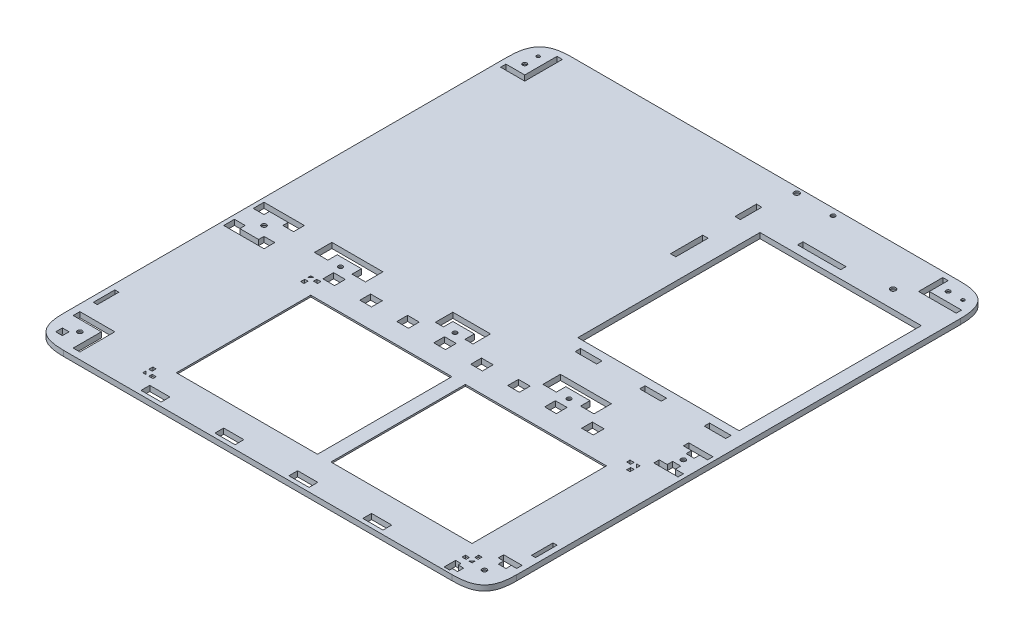
from build123d import *

# Parameters (mm, degrees)
SKETCH1_W                                    = 337
SKETCH1_H                                    = 377.97
SKETCH1_W_2                                  = 240
SKETCH1_H_2                                  = 120
BOSS_EXTRUDE1_DEPTH                          = 4
FILLET1_SIZE                                 = 24
SKETCH3_R                                    = 1.75
SKETCH3_R_2                                  = 2
SKETCH3_R_3                                  = 1.6
SKETCH3_R_4                                  = 1.2
SKETCH3_W                                    = 5
SKETCH3_H                                    = 5
SKETCH3_W_2                                  = 3
SKETCH3_H_2                                  = 16
SKETCH3_W_3                                  = 4
SKETCH3_H_3                                  = 24
SKETCH3_W_4                                  = 120
SKETCH3_H_4                                  = 135.5
SKETCH3_W_5                                  = 16
SKETCH3_H_5                                  = 4
SKETCH3_W_6                                  = 32
CUT_EXTRUDE1_DEPTH                           = 4
CUT_EXTRUDE2_REACH                           = 508.405
SKETCH5_W                                    = 2.5
SKETCH5_H                                    = 3
SKETCH5_W_2                                  = 3
SKETCH5_H_2                                  = 2.5
MIRROR1_AT_THE_SECOND_PLANE_COPY_1_REACH     = 508.405
MIRROR1_AT_THE_SECOND_PLANE_COPY_1_SKETC_W   = 2.5
MIRROR1_AT_THE_SECOND_PLANE_COPY_1_SKETC_H   = 3
MIRROR1_AT_THE_SECOND_PLANE_COPY_1_SKETC_W_2 = 3
MIRROR1_AT_THE_SECOND_PLANE_COPY_1_SKETC_H_2 = 2.5
SKETCH6_R                                    = 3.5
SKETCH6_R_2                                  = 3
CUT_EXTRUDE3_DEPTH                           = 2.8
CUT_EXTRUDE4_REACH                           = 508.405
SKETCH7_W                                    = 8.7
SKETCH7_H                                    = 8
LPATTERN1_COUNT                              = 8
LPATTERN1_PITCH                              = 27.5
CUT_EXTRUDE5_REACH                           = 508.405
CUT_EXTRUDE6_REACH                           = 508.405
SKETCH9_R                                    = 1.6
SKETCH10_R                                   = 3.5
CUT_EXTRUDE7_DEPTH                           = 2.8
CUT_EXTRUDE8_REACH                           = 508.405
SKETCH11_R                                   = 1.6
SKETCH12_R                                   = 3.5
CUT_EXTRUDE9_DEPTH                           = 2.8
SKETCH13_W                                   = 15
SKETCH13_H                                   = 6.5
CUT_EXTRUDE10_DEPTH                          = 4
LPATTERN2_COUNT                              = 4
LPATTERN2_PITCH                              = 55
SKETCH15_W                                   = 240
SKETCH15_H                                   = 120
SKETCH15_W_2                                 = 105
SKETCH15_H_2                                 = 100
BOSS_EXTRUDE2_DEPTH                          = 1.2


with BuildPart() as part:
    # Sketch1 → Boss-Extrude1 (new body)
    with BuildSketch(Plane(origin=(0, 0, 0), x_dir=(1, 0, 0), z_dir=(0, 1, 0))):
        with Locations((168.5, 188.985)):
            Rectangle(SKETCH1_W, SKETCH1_H)
        with Locations((190.28, 77.5)):
            Rectangle(SKETCH1_W_2, SKETCH1_H_2, mode=Mode.SUBTRACT)
    extrude(amount=-BOSS_EXTRUDE1_DEPTH)

    # Fillet1
    # a fillet whose section is not a circle: 24 mm, written as the material it takes off along each edge
    with BuildSketch(Plane(origin=(0, 60, 0), x_dir=(1, 0, 0), z_dir=(0, -1, 0))) as fillet1_piece_1:
        with BuildLine():
            Bezier((FILLET1_SIZE, 0), (0, 0), (0, -FILLET1_SIZE), weights=[1, 1.222222222, 1])
            Line((0, -FILLET1_SIZE), (0, 0))
            Line((0, 0), (FILLET1_SIZE, 0))
        make_face()
    extrude(amount=124, mode=Mode.SUBTRACT)
    with BuildSketch(Plane(origin=(337, 60, 0), x_dir=(-1, 0, 0), z_dir=(0, -1, 0)), Plane(origin=(0, 60, -377.97), x_dir=(1, 0, 0), z_dir=(0, -1, 0)), Plane(origin=(337, 60, -377.97), x_dir=(0, 0, 1), z_dir=(0, -1, 0))) as fillet1_piece_2:
        with BuildLine():
            Bezier((FILLET1_SIZE, 0), (0, 0), (0, FILLET1_SIZE), weights=[1, 1.222222222, 1])
            Line((0, FILLET1_SIZE), (0, 0))
            Line((0, 0), (FILLET1_SIZE, 0))
        make_face()
    extrude(amount=124, mode=Mode.SUBTRACT)

    # Sketch3 → Cut-Extrude1 (cut)
    with BuildSketch(Plane(origin=(0, 0, 0), x_dir=(1, 0, 0), z_dir=(0, 1, 0))):
        with Locations(Location((322, 15, 0), (0, 0, 270))):
            Circle(SKETCH3_R)
        with Locations(Location((18, 18, 0), (0, 0, 270))):
            Circle(SKETCH3_R)
        with Locations(Location((18, 155, 0), (0, 0, 270))):
            Circle(SKETCH3_R)
        with Locations(Location((325, 160, 0), (0, 0, 270))):
            Circle(SKETCH3_R)
        with Locations(Location((195.4, 373.97, 0), (0, 0, 270))):
            Circle(SKETCH3_R_2)
        with Locations(Location((293, 347.97, 0), (0, 0, 270))):
            Circle(SKETCH3_R_2)
        with Locations(Location((315, 366.97, 0), (0, 0, 270))):
            Circle(SKETCH3_R_3)
        with Locations(Location((326, 366.97, 0), (0, 0, 270))):
            Circle(SKETCH3_R_4)
        with Locations(Location((11, 355.97, 0), (0, 0, 270))):
            Circle(SKETCH3_R_3)
        with Locations(Location((11, 365.97, 0), (0, 0, 270))):
            Circle(SKETCH3_R_4)
        with Locations(Location((223.4, 372.97, 0), (0, 0, 270))):
            Circle(SKETCH3_R_3)
        Polygon((309, 4), (309, 2), (305, 2), (305, 10.5), (309, 10.5), (309, 8.5), (313, 8.5), (313, 4), align=None)
        Polygon((329, 28), (333, 28), (333, 32), (319.28, 32), (319.28, 28), (323.28, 28), (323.28, 24), (329, 24), align=None)
        Polygon((328, 151), (334, 151), (334, 147), (316, 147), (316, 151), (322, 151), (322, 155), (328, 155), align=None)
        Polygon((26, 5), (31, 5), (31, 31), (26, 31), (5, 31), (5, 26), (26, 26), align=None)
        with Locations((11.5, 11.5)):
            Rectangle(SKETCH3_W, SKETCH3_H)
        Polygon((3, 140), (33, 140), (33, 144), (33, 148), (25, 148), (25, 144), (11, 144), (11, 148), (3, 148), (3, 144), align=None)
        Polygon((3, 170), (33, 170), (33, 166), (33, 162), (25, 162), (25, 166), (11, 166), (11, 162), (3, 162), (3, 166), align=None)
        Polygon((328, 169), (334, 169), (334, 173), (316, 173), (316, 169), (322, 169), (322, 165), (328, 165), align=None)
        with Locations((331.5, 50)):
            Rectangle(SKETCH3_W_2, SKETCH3_H_2)
        with Locations((5.5, 50)):
            Rectangle(SKETCH3_W_2, SKETCH3_H_2)
        with Locations((189.4, 343.97)):
            Rectangle(SKETCH3_W_3, SKETCH3_H_2)
        with Locations((189.4, 299.97)):
            Rectangle(SKETCH3_W_3, SKETCH3_H_3)
        with Locations((267, 267.22)):
            Rectangle(SKETCH3_W_4, SKETCH3_H_4)
        with Locations((319, 191.47)):
            Rectangle(SKETCH3_W_5, SKETCH3_H_5)
        with Locations((271, 191.47)):
            Rectangle(SKETCH3_W_5, SKETCH3_H_5)
        with Locations((223, 191.47)):
            Rectangle(SKETCH3_W_5, SKETCH3_H_5)
        with Locations((245, 342.97)):
            Rectangle(SKETCH3_W_6, SKETCH3_H_5)
        Polygon((332, 355.97), (304, 355.97), (304, 359.97), (304, 373.97), (308, 373.97), (308, 359.97), (332, 359.97), align=None)
        Polygon((18, 372.97), (22, 372.97), (22, 344.97), (18, 344.97), (4, 344.97), (4, 348.97), (18, 348.97), align=None)
    extrude(amount=-CUT_EXTRUDE1_DEPTH, mode=Mode.SUBTRACT)

    # Sketch5 → Cut-Extrude2 (cut, up to next)
    with BuildSketch(Plane(origin=(0, 0, 0), x_dir=(1, 0, 0), z_dir=(0, 1, 0)), mode=Mode.PRIVATE) as cut_extrude2_sk1:
        Polygon((310.28, 15), (312.78, 15), (312.78, 17.5), align=None)
    cut_extrude2_tool1 = extrude(cut_extrude2_sk1.sketch, amount=-CUT_EXTRUDE2_REACH, mode=Mode.PRIVATE) & part.part
    # Sketch5 → Cut-Extrude2 (cut, up to next)
    with BuildSketch(Plane(origin=(0, 0, 0), x_dir=(1, 0, 0), z_dir=(0, 1, 0)), mode=Mode.PRIVATE) as cut_extrude2_sk2:
        with Locations((311.53, 21)):
            Rectangle(SKETCH5_W, SKETCH5_H)
    cut_extrude2_tool2 = extrude(cut_extrude2_sk2.sketch, amount=-CUT_EXTRUDE2_REACH, mode=Mode.PRIVATE) & part.part
    # Sketch5 → Cut-Extrude2 (cut, up to next)
    with BuildSketch(Plane(origin=(0, 0, 0), x_dir=(1, 0, 0), z_dir=(0, 1, 0)), mode=Mode.PRIVATE) as cut_extrude2_sk3:
        with Locations((306.78, 16.25)):
            Rectangle(SKETCH5_W_2, SKETCH5_H_2)
    cut_extrude2_tool3 = extrude(cut_extrude2_sk3.sketch, amount=-CUT_EXTRUDE2_REACH, mode=Mode.PRIVATE) & part.part
    cut_extrude2_1 = cut_extrude2_tool1.solids().sort_by_distance((311.946667, 0, -15.833333))[0]
    add(cut_extrude2_1, mode=Mode.SUBTRACT)
    cut_extrude2_2 = cut_extrude2_tool2.solids().sort_by_distance((311.53, 0, -21))[0]
    add(cut_extrude2_2, mode=Mode.SUBTRACT)
    cut_extrude2_3 = cut_extrude2_tool3.solids().sort_by_distance((306.78, 0, -16.25))[0]
    add(cut_extrude2_3, mode=Mode.SUBTRACT)
    cut_extrude2 = cut_extrude2_1 + cut_extrude2_2 + cut_extrude2_3  # Cut-Extrude2 as one shape, for the pattern or mirror that repeats it

    # Mirror1: Cut-Extrude2 across plane
    add(cut_extrude2.mirror(Plane.XY.offset(-77.5)), mode=Mode.SUBTRACT)

    # Mirror1 at the second plane: Cut-Extrude2 across plane
    add(cut_extrude2.mirror(Plane.ZY.offset(-190.28)), mode=Mode.SUBTRACT)

    # Mirror1 at the second plane copy 1 sketc → Mirror1 at the second plane copy 1 (cut, up to next)
    with BuildSketch(Plane(origin=(380.56, 0, -155), x_dir=(-1, 0, 0), z_dir=(0, 1, 0)), mode=Mode.PRIVATE) as mirror1_at_the_second_plane_copy_1_sk1:
        Polygon((310.28, 15), (312.78, 15), (312.78, 17.5), align=None)
    mirror1_at_the_second_plane_copy_1_tool1 = extrude(mirror1_at_the_second_plane_copy_1_sk1.sketch, amount=-MIRROR1_AT_THE_SECOND_PLANE_COPY_1_REACH, mode=Mode.PRIVATE) & part.part
    # Mirror1 at the second plane copy 1 sketc → Mirror1 at the second plane copy 1 (cut, up to next)
    with BuildSketch(Plane(origin=(380.56, 0, -155), x_dir=(-1, 0, 0), z_dir=(0, 1, 0)), mode=Mode.PRIVATE) as mirror1_at_the_second_plane_copy_1_sk2:
        with Locations((311.53, 21)):
            Rectangle(MIRROR1_AT_THE_SECOND_PLANE_COPY_1_SKETC_W, MIRROR1_AT_THE_SECOND_PLANE_COPY_1_SKETC_H)
    mirror1_at_the_second_plane_copy_1_tool2 = extrude(mirror1_at_the_second_plane_copy_1_sk2.sketch, amount=-MIRROR1_AT_THE_SECOND_PLANE_COPY_1_REACH, mode=Mode.PRIVATE) & part.part
    # Mirror1 at the second plane copy 1 sketc → Mirror1 at the second plane copy 1 (cut, up to next)
    with BuildSketch(Plane(origin=(380.56, 0, -155), x_dir=(-1, 0, 0), z_dir=(0, 1, 0)), mode=Mode.PRIVATE) as mirror1_at_the_second_plane_copy_1_sk3:
        with Locations((306.78, 16.25)):
            Rectangle(MIRROR1_AT_THE_SECOND_PLANE_COPY_1_SKETC_W_2, MIRROR1_AT_THE_SECOND_PLANE_COPY_1_SKETC_H_2)
    mirror1_at_the_second_plane_copy_1_tool3 = extrude(mirror1_at_the_second_plane_copy_1_sk3.sketch, amount=-MIRROR1_AT_THE_SECOND_PLANE_COPY_1_REACH, mode=Mode.PRIVATE) & part.part
    add(mirror1_at_the_second_plane_copy_1_tool1.solids().sort_by_distance((68.613333, 0, -139.166667))[0], mode=Mode.SUBTRACT)
    add(mirror1_at_the_second_plane_copy_1_tool2.solids().sort_by_distance((69.03, 0, -134))[0], mode=Mode.SUBTRACT)
    add(mirror1_at_the_second_plane_copy_1_tool3.solids().sort_by_distance((73.78, 0, -138.75))[0], mode=Mode.SUBTRACT)

    # Sketch6 → Cut-Extrude3 (cut)
    with BuildSketch(Plane.XZ.offset(4)):
        with Locations(Location((18, -155, 0), (0, 0, 270))):
            Circle(SKETCH6_R)
        with Locations(Location((18, -18, 0), (0, 0, 270))):
            Circle(SKETCH6_R)
        with Locations(Location((322, -15, 0), (0, 0, 270))):
            Circle(SKETCH6_R)
        with Locations(Location((325, -160, 0), (0, 0, 270))):
            Circle(SKETCH6_R)
        with Locations(Location((195.4, -373.97, 0), (0, 0, 270))):
            Circle(SKETCH6_R)
        with Locations(Location((293, -347.97, 0), (0, 0, 270))):
            Circle(SKETCH6_R)
        with Locations(Location((315, -366.97, 0), (0, 0, 270))):
            Circle(SKETCH6_R)
        with Locations(Location((326, -366.97, 0), (0, 0, 270))):
            Circle(SKETCH6_R_2)
        with Locations(Location((11, -355.97, 0), (0, 0, 270))):
            Circle(SKETCH6_R)
        with Locations(Location((11, -365.97, 0), (0, 0, 270))):
            Circle(SKETCH6_R_2)
        with Locations(Location((223.4, -372.97, 0), (0, 0, 270))):
            Circle(SKETCH6_R)
    extrude(amount=-CUT_EXTRUDE3_DEPTH, mode=Mode.SUBTRACT)

    # Sketch7 → Cut-Extrude4 (cut, up to next)
    with BuildSketch(Plane(origin=(0, 0, 0), x_dir=(1, 0, 0), z_dir=(0, 1, 0)), mode=Mode.PRIVATE) as cut_extrude4_sk1:
        with Locations((271.13, 146.5)):
            Rectangle(SKETCH7_W, SKETCH7_H)
    cut_extrude4_tool1 = extrude(cut_extrude4_sk1.sketch, amount=-CUT_EXTRUDE4_REACH, mode=Mode.PRIVATE) & part.part
    cut_extrude4 = cut_extrude4_tool1.solids().sort_by_distance((271.13, 0, -146.5))[0]
    add(cut_extrude4, mode=Mode.SUBTRACT)

    # LPattern1: Cut-Extrude4 ×8
    with Locations(*[(-i * LPATTERN1_PITCH, 0, 0) for i in range(1, LPATTERN1_COUNT)]):
        add(cut_extrude4, mode=Mode.SUBTRACT)

    # Sketch8 → Cut-Extrude5 (cut, up to next)
    with BuildSketch(Plane(origin=(0, 0, 0), x_dir=(1, 0, 0), z_dir=(0, 1, 0)), mode=Mode.PRIVATE) as cut_extrude5_sk1:
        Polygon((262.1, 156.38), (252.1, 156.38), (252.1, 163.38), (234.1, 163.38), (234.1, 156.38), (224.1, 156.38), (224.1, 163.38), (224.1, 169.38), (262.1, 169.38), (262.1, 163.38), align=None)
    cut_extrude5_tool1 = extrude(cut_extrude5_sk1.sketch, amount=-CUT_EXTRUDE5_REACH, mode=Mode.PRIVATE) & part.part
    cut_extrude5 = cut_extrude5_tool1.solids().sort_by_distance((243.1, 0, -163.907174))[0]
    add(cut_extrude5, mode=Mode.SUBTRACT)

    # Sketch9 → Cut-Extrude6 (cut, up to next)
    with BuildSketch(Plane(origin=(0, 0, 0), x_dir=(1, 0, 0), z_dir=(0, 1, 0)), mode=Mode.PRIVATE) as cut_extrude6_sk1:
        with Locations(Location((243.1, 156.88, 0), (0, 0, 270))):
            Circle(SKETCH9_R)
    cut_extrude6_tool1 = extrude(cut_extrude6_sk1.sketch, amount=-CUT_EXTRUDE6_REACH, mode=Mode.PRIVATE) & part.part
    cut_extrude6 = cut_extrude6_tool1.solids().sort_by_distance((243.1, 0, -156.88))[0]
    add(cut_extrude6, mode=Mode.SUBTRACT)

    # Sketch10 → Cut-Extrude7 (cut)
    with BuildSketch(Plane.XZ.offset(4)):
        with Locations(Location((243.1, -156.88, 0), (0, 0, 270))):
            Circle(SKETCH10_R)
    cut_extrude7 = extrude(amount=-CUT_EXTRUDE7_DEPTH, mode=Mode.SUBTRACT)

    # Mirror2: Cut-Extrude5, Cut-Extrude6, Cut-Extrude7 across plane
    add(cut_extrude5.mirror(Plane(origin=(158.1, 0, 0), x_dir=(0, 0, 1), z_dir=(1, 0, 0))), mode=Mode.SUBTRACT)
    add(cut_extrude6.mirror(Plane(origin=(158.1, 0, 0), x_dir=(0, 0, 1), z_dir=(1, 0, 0))), mode=Mode.SUBTRACT)
    add(cut_extrude7.mirror(Plane(origin=(158.1, 0, 0), x_dir=(0, 0, 1), z_dir=(1, 0, 0))), mode=Mode.SUBTRACT)

    # Sketch11 → Cut-Extrude8 (cut, up to next)
    with BuildSketch(Plane(origin=(0, 0, 0), x_dir=(1, 0, 0), z_dir=(0, 1, 0)), mode=Mode.PRIVATE) as cut_extrude8_sk1:
        with Locations(Location((158.1, 156.88, 0), (0, 0, 270))):
            Circle(SKETCH11_R)
    cut_extrude8_tool1 = extrude(cut_extrude8_sk1.sketch, amount=-CUT_EXTRUDE8_REACH, mode=Mode.PRIVATE) & part.part
    # Sketch11 → Cut-Extrude8 (cut, up to next)
    with BuildSketch(Plane(origin=(0, 0, 0), x_dir=(1, 0, 0), z_dir=(0, 1, 0)), mode=Mode.PRIVATE) as cut_extrude8_sk2:
        Polygon((172.1, 169.38), (144.1, 169.38), (144.1, 163.38), (144.1, 156.38), (150.1, 156.38), (150.1, 163.38), (166.1, 163.38), (166.1, 156.38), (172.1, 156.38), (172.1, 163.38), align=None)
    cut_extrude8_tool2 = extrude(cut_extrude8_sk2.sketch, amount=-CUT_EXTRUDE8_REACH, mode=Mode.PRIVATE) & part.part
    add(cut_extrude8_tool1.solids().sort_by_distance((158.1, 0, -156.88))[0], mode=Mode.SUBTRACT)
    add(cut_extrude8_tool2.solids().sort_by_distance((158.1, 0, -164.213333))[0], mode=Mode.SUBTRACT)

    # Sketch12 → Cut-Extrude9 (cut)
    with BuildSketch(Plane.XZ.offset(4)):
        with Locations(Location((158.1, -156.88, 0), (0, 0, 270))):
            Circle(SKETCH12_R)
    extrude(amount=-CUT_EXTRUDE9_DEPTH, mode=Mode.SUBTRACT)

    # Sketch13 → Cut-Extrude10 (cut)
    with BuildSketch(Plane(origin=(0, 0, 0), x_dir=(1, 0, 0), z_dir=(0, 1, 0))):
        with Locations((86, 6.25)):
            Rectangle(SKETCH13_W, SKETCH13_H)
    cut_extrude10 = extrude(amount=-CUT_EXTRUDE10_DEPTH, mode=Mode.SUBTRACT)

    # LPattern2: Cut-Extrude10 ×4
    with Locations(*[(i * LPATTERN2_PITCH, 0, 0) for i in range(1, LPATTERN2_COUNT)]):
        add(cut_extrude10, mode=Mode.SUBTRACT)

    # Sketch15 → Boss-Extrude2 (add)
    with BuildSketch(Plane(origin=(0, 0, 0), x_dir=(1, 0, 0), z_dir=(0, 1, 0))):
        with Locations((190.28, 77.5)):
            Rectangle(SKETCH15_W, SKETCH15_H)
        with Locations((132.78, 77.5)):
            Rectangle(SKETCH15_W_2, SKETCH15_H_2, mode=Mode.SUBTRACT)
        with Locations((247.78, 77.5)):
            Rectangle(SKETCH15_W_2, SKETCH15_H_2, mode=Mode.SUBTRACT)
    extrude(amount=-BOSS_EXTRUDE2_DEPTH)


solid = part.part
